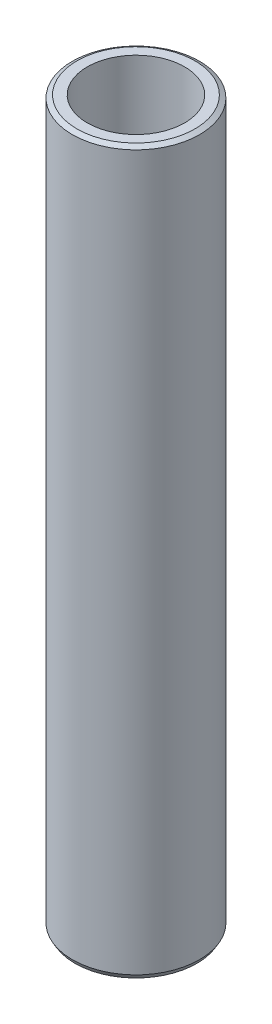
from build123d import *
from OCP.BRepFilletAPI import BRepFilletAPI_MakeChamfer

# Parameters (mm, degrees)
SKETCH1_R           = 35
BOSS_EXTRUDE1_DEPTH = 397.038890579
SKETCH2_R           = 26.761406227
CUT_EXTRUDE1_DEPTH  = 401.112335016
CHAMFER1_SIZE       = 1.465612514
CHAMFER1_SIZE2      = 2.538515338


with BuildPart() as part:
    # Sketch1 → Boss-Extrude1 (new body)
    with BuildSketch(Plane(origin=(0, 0, 0), x_dir=(1, 0, 0), z_dir=(0, 1, 0))):
        Circle(SKETCH1_R)
    extrude(amount=BOSS_EXTRUDE1_DEPTH)

    # Sketch2 → Cut-Extrude1 (cut, through all)
    with BuildSketch(Plane(origin=(0, 0, 0), x_dir=(1, 0, 0), z_dir=(0, 1, 0))):
        Circle(SKETCH2_R)
    extrude(amount=CUT_EXTRUDE1_DEPTH, mode=Mode.SUBTRACT)

    # Chamfer1: one chamfer whose edges measure the first distance from different faces: ONE call of the kernel's chamfer builder (chamfer() names one face for all edges)
    chamfer1_edges_1 = [part.edges().sort_by_distance(p)[0] for p in [
        (-35, 397.038890579, 0),
    ]]
    chamfer1_side_1 = [part.faces().sort_by_distance(p)[0] for p in [
        (-35, 198.519445289, 0),
    ]]
    chamfer1_edges_2 = [part.edges().sort_by_distance(p)[0] for p in [
        (-35, 0, 0),
    ]]
    chamfer1_side_2 = [part.faces().sort_by_distance(p)[0] for p in [
        (-34.010050506, 0, 0),
    ]]
    chamfer1 = BRepFilletAPI_MakeChamfer(part.part.solid().wrapped)
    for e in chamfer1_edges_1:
        chamfer1.Add(CHAMFER1_SIZE, CHAMFER1_SIZE2, e.wrapped, chamfer1_side_1[0].wrapped)  # the first distance lies on this face
    for e in chamfer1_edges_2:
        chamfer1.Add(CHAMFER1_SIZE, CHAMFER1_SIZE2, e.wrapped, chamfer1_side_2[0].wrapped)  # the first distance lies on this face
    add(Compound.cast(chamfer1.Shape()), mode=Mode.REPLACE)


solid = part.part
